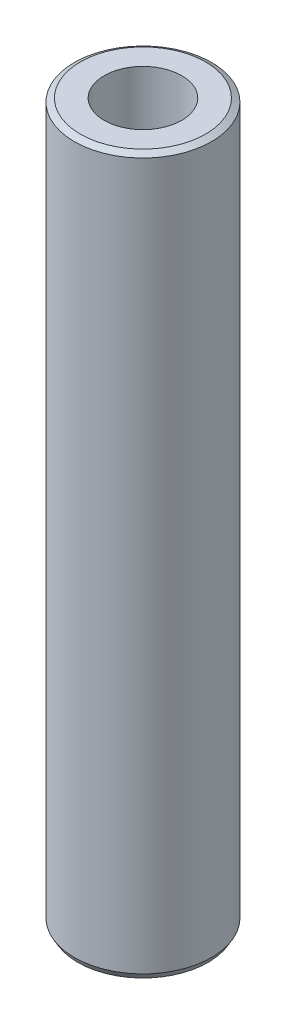
from build123d import *
from OCP.BRepFilletAPI import BRepFilletAPI_MakeChamfer

# Parameters (mm, degrees)
SKETCH1_R           = 57.5
BOSS_EXTRUDE1_DEPTH = 600
SKETCH2_R           = 32.491644495
CUT_EXTRUDE1_DEPTH  = 606.485342515
CHAMFER1_SIZE       = 2.910933851
CHAMFER1_SIZE2      = 5.041885328


with BuildPart() as part:
    # Sketch1 → Boss-Extrude1 (new body)
    with BuildSketch(Plane(origin=(0, 0, 0), x_dir=(1, 0, 0), z_dir=(0, 1, 0))):
        Circle(SKETCH1_R)
    extrude(amount=BOSS_EXTRUDE1_DEPTH)

    # Sketch2 → Cut-Extrude1 (cut, through all)
    with BuildSketch(Plane(origin=(0, 0, 0), x_dir=(1, 0, 0), z_dir=(0, 1, 0))):
        Circle(SKETCH2_R)
    extrude(amount=CUT_EXTRUDE1_DEPTH, mode=Mode.SUBTRACT)

    # Chamfer1: one chamfer whose edges measure the first distance from different faces: ONE call of the kernel's chamfer builder (chamfer() names one face for all edges)
    chamfer1_edges_1 = [part.edges().sort_by_distance(p)[0] for p in [
        (-57.5, 600, 0),
    ]]
    chamfer1_side_1 = [part.faces().sort_by_distance(p)[0] for p in [
        (-57.5, 300, 0),
    ]]
    chamfer1_edges_2 = [part.edges().sort_by_distance(p)[0] for p in [
        (-57.5, 0, 0),
    ]]
    chamfer1_side_2 = [part.faces().sort_by_distance(p)[0] for p in [
        (-55.873654403, 0, 0),
    ]]
    chamfer1 = BRepFilletAPI_MakeChamfer(part.part.solid().wrapped)
    for e in chamfer1_edges_1:
        chamfer1.Add(CHAMFER1_SIZE, CHAMFER1_SIZE2, e.wrapped, chamfer1_side_1[0].wrapped)  # the first distance lies on this face
    for e in chamfer1_edges_2:
        chamfer1.Add(CHAMFER1_SIZE, CHAMFER1_SIZE2, e.wrapped, chamfer1_side_2[0].wrapped)  # the first distance lies on this face
    add(Compound.cast(chamfer1.Shape()), mode=Mode.REPLACE)


solid = part.part
